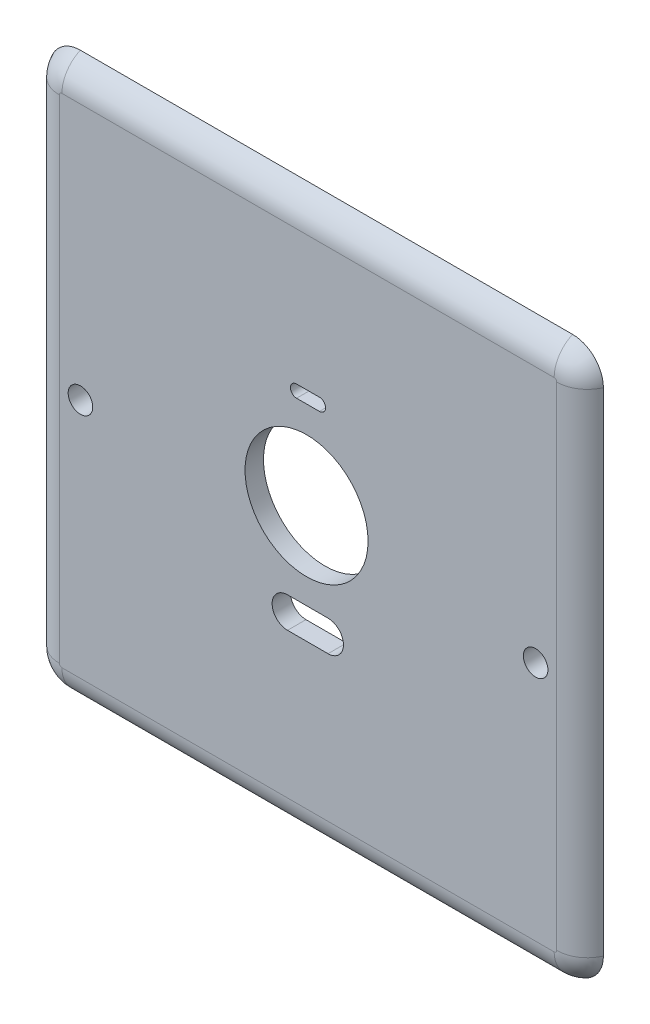
from build123d import *

# Parameters (mm, degrees)
SKETCH1_W           = 90
SKETCH1_H           = 90
BOSS_EXTRUDE1_DEPTH = 3
FILLET1_R           = 5
FILLET3_R           = 5
SKETCH2_R           = 10
SKETCH2_R_2         = 2
CUT_EXTRUDE1_DEPTH  = 3


with BuildPart() as part:
    # Sketch1 → Boss-Extrude1 (new body)
    with BuildSketch(Plane.XY):
        with Locations((-51.25, -17.8125)):
            Rectangle(SKETCH1_W, SKETCH1_H)
    extrude(amount=BOSS_EXTRUDE1_DEPTH)

    # Fillet1
    fillet1_edges = [part.edges().sort_by_distance(p)[0] for p in [
        (-96.25, 27.1875, 1.5),
        (-6.25, 27.1875, 1.5),
        (-6.25, -62.8125, 1.5),
        (-96.25, -62.8125, 1.5),
    ]]
    fillet(fillet1_edges, radius=FILLET1_R)

    # Fillet3
    # the kernel refuses this fillet: 5 mm, written as the material it takes off along each edge
    with BuildSketch(Plane(origin=(-91.25, 22.1875, 3), x_dir=(0, 1, 0), z_dir=(1, 0, 0))) as fillet3_piece_1:
        with BuildLine():
            CenterArc((0.417424305, -5), FILLET3_R, 23.578178478, 66.421821522)
            Line((0.417424305, 0), (0.417424305, 0.1))
            Line((0.417424305, 0.1), (5, 0.1))
            Line((5, 0.1), (5.1, 0))
            ThreePointArc((5.1, 0), (5.1, -1.5), (5.091651514, -2.96))
            Line((5.091651514, -2.96), (5, -3))
        make_face()
    revolve(axis=Axis((-91.25, 22.1875, 3), (0, 0, 1)), revolution_arc=90, mode=Mode.SUBTRACT)
    with BuildSketch(Plane(origin=(-91.25, 27.1875, 3), x_dir=(0, 0, -1), z_dir=(1, 0, 0))) as fillet3_piece_2:
        with BuildLine():
            CenterArc((5, -4.582575695), FILLET3_R, 113.578178478, 66.421821522)
            Line((0, -4.582575695), (-0.1, -4.582575695))
            Line((-0.1, -4.582575695), (-0.1, 0))
            Line((-0.1, 0), (0, 0.1))
            ThreePointArc((0, 0.1), (1.5, 0.1), (2.96, 0.091651514))
            Line((2.96, 0.091651514), (3, 0))
        make_face()
    extrude(amount=80, mode=Mode.SUBTRACT)
    with BuildSketch(Plane(origin=(-11.25, 22.1875, 3), x_dir=(0, 1, 0), z_dir=(-1, 0, 0))) as fillet3_piece_3:
        with BuildLine():
            CenterArc((0.417424305, 5), FILLET3_R, 270, 66.421821522)
            Line((0.417424305, 0), (0.417424305, -0.1))
            Line((0.417424305, -0.1), (5, -0.1))
            Line((5, -0.1), (5.1, 0))
            ThreePointArc((5.1, 0), (5.1, 1.5), (5.091651514, 2.96))
            Line((5.091651514, 2.96), (5, 3))
        make_face()
    revolve(axis=Axis((-11.25, 22.1875, 3), (0, 0, -1)), revolution_arc=90, mode=Mode.SUBTRACT)
    with BuildSketch(Plane(origin=(-6.25, 22.1875, 3), x_dir=(-1, 0, 0), z_dir=(0, -1, 0)), Plane(origin=(-11.25, -62.8125, 3), x_dir=(0, 1, 0), z_dir=(-1, 0, 0)), Plane(origin=(-96.25, -57.8125, 3), x_dir=(1, 0, 0), z_dir=(0, 1, 0))) as fillet3_piece_4:
        with BuildLine():
            CenterArc((4.582575695, 5), FILLET3_R, 203.578178478, 66.421821522)
            Line((0, 3), (-0.091651514, 2.96))
            ThreePointArc((-0.091651514, 2.96), (-0.1, 1.5), (-0.1, 0))
            Line((-0.1, 0), (0, -0.1))
            Line((0, -0.1), (4.582575695, -0.1))
            Line((4.582575695, -0.1), (4.582575695, 0))
        make_face()
    extrude(amount=80, mode=Mode.SUBTRACT)
    with BuildSketch(Plane(origin=(-11.25, -57.8125, 3), x_dir=(1, 0, 0), z_dir=(0, 1, 0))) as fillet3_piece_5:
        with BuildLine():
            CenterArc((0.417424305, 5), FILLET3_R, 270, 66.421821522)
            Line((5, 3), (5.091651514, 2.96))
            ThreePointArc((5.091651514, 2.96), (5.1, 1.5), (5.1, 0))
            Line((5.1, 0), (5, -0.1))
            Line((5, -0.1), (0.417424305, -0.1))
            Line((0.417424305, -0.1), (0.417424305, 0))
        make_face()
    revolve(axis=Axis((-11.25, -57.8125, 3), (0, 0, -1)), revolution_arc=90, mode=Mode.SUBTRACT)
    with BuildSketch(Plane(origin=(-91.25, -57.8125, 3), x_dir=(0, -1, 0), z_dir=(1, 0, 0))) as fillet3_piece_6:
        with BuildLine():
            CenterArc((0.417424305, 5), FILLET3_R, 270, 66.421821522)
            Line((5, 3), (5.091651514, 2.96))
            ThreePointArc((5.091651514, 2.96), (5.1, 1.5), (5.1, 0))
            Line((5.1, 0), (5, -0.1))
            Line((5, -0.1), (0.417424305, -0.1))
            Line((0.417424305, -0.1), (0.417424305, 0))
        make_face()
    revolve(axis=Axis((-91.25, -57.8125, 3), (0, 0, -1)), revolution_arc=90, mode=Mode.SUBTRACT)

    # Sketch2 → Cut-Extrude1 (cut)
    with BuildSketch(Plane.XY.offset(3)):
        with Locations((-51.491961851, -15.545023704)):
            Circle(SKETCH2_R)
        with Locations((-88.238370767, -19.051344954)):
            Circle(SKETCH2_R_2)
        with Locations((-14.261629233, -19.051344954)):
            Circle(SKETCH2_R_2)
        with BuildLine():
            Line((-54.583479712, -29.628619656), (-47.996622456, -29.628619656))
            ThreePointArc((-47.996622456, -29.628619656), (-45.496622456, -32.128619656), (-47.996622456, -34.628619656))
            Line((-47.996622456, -34.628619656), (-54.583479712, -34.628619656))
            ThreePointArc((-54.583479712, -34.628619656), (-57.083479712, -32.128619656), (-54.583479712, -29.628619656))
        make_face()
        with BuildLine():
            Line((-53.113614206, 0.771303592), (-49.397460357, 0.771303592))
            ThreePointArc((-49.397460357, 0.771303592), (-48.397460357, -0.228696408), (-49.397460357, -1.228696408))
            Line((-49.397460357, -1.228696408), (-53.113614206, -1.228696408))
            ThreePointArc((-53.113614206, -1.228696408), (-54.113614206, -0.228696408), (-53.113614206, 0.771303592))
        make_face()
    extrude(amount=-CUT_EXTRUDE1_DEPTH, mode=Mode.SUBTRACT)


solid = part.part
